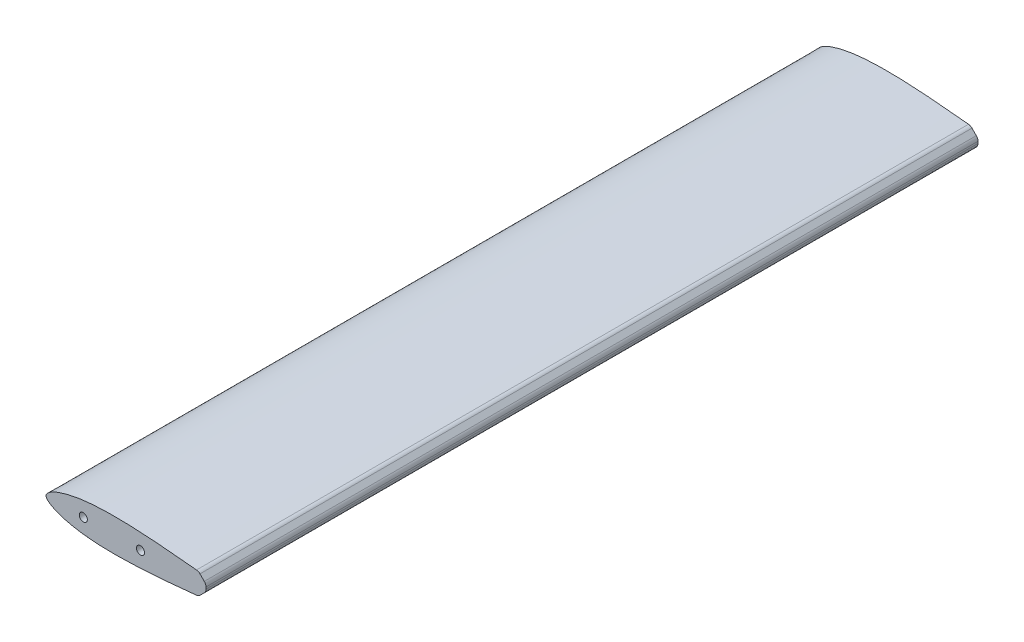
from build123d import *

# Parameters (mm, degrees)
BOSS_EXTRUDE1_DEPTH = 342.9
CUT_EXTRUDE1_REACH  = 726.83
SKETCH5_R           = 3.6000000000000014
CUT_EXTRUDE2_DEPTH  = 725.8296670733237
FILLET1_R           = 5.08


with BuildPart() as part:
    # Sketch4 → Boss-Extrude1 (new, symmetric)
    with BuildSketch(Plane.XY):
        with BuildLine():
            add(Edge.make_bspline(
                [(234.188, -3e-17), (234.1879999999999, 0.01555368673717536), (232.4627422380163, 0.0763011183498608), (230.74526647764503, 0.2925271697301719), (226.67713229868264, 0.685160998526905), (221.75356854698836, 1.1640077356321055), (215.37294620070008, 1.6852254916752147), (207.86062662630553, 2.3192547241588373), (199.2232284506973, 3.079647274565367), (189.62491700027604, 3.9790665220835195), (179.1985355820121, 5.004226397420742), (168.09946427080857, 6.136829344987135), (156.48495923102257, 7.353633283154771), (144.51299742857503, 8.611742711703746), (132.3399741562958, 9.871667449087782), (120.11646789402246, 11.085202621751511), (107.98355224875537, 12.19281227627895), (96.07511697796379, 13.149500525501221), (84.51142924294103, 13.902296199554154), (73.39893065705205, 14.404277626743035), (62.83036591934086, 14.617543900453633), (52.890708700755226, 14.52889921311447), (43.65270125249773, 14.118780647976617), (35.176869617070736, 13.380664351662944), (27.509827784431533, 12.317631060614895), (20.692419045179847, 10.965262556118512), (14.765041279961295, 9.389914810638238), (9.769355541344568, 7.6437531971927895), (5.7494434702079165, 5.796207761047075), (2.7281368480217365, 3.8707650647214633), (0.7551383825718299, 2.0668649583695786), (-0.30700200067074673, 1.697e-14), (0.7551383825717297, -2.0668649583693863), (2.728136848021755, -3.8707650647213954), (5.74944347020787, -5.7962077610469045), (9.769355541344595, -7.643753197192716), (14.765041279961304, -9.389914810638118), (20.69241904517994, -10.965262556118454), (27.509827784431586, -12.317631060614838), (35.17686961707083, -13.380664351662807), (43.65270125249773, -14.118780647976545), (52.89070870075546, -14.52889921311428), (62.83036591934106, -14.6175439004534), (73.39893065705176, -14.404277626743013), (84.51142924294103, -13.902296199554002), (96.07511697796434, -13.14950052550129), (107.98355224875506, -12.192812276278886), (120.11646789402214, -11.085202621751522), (132.33997415629577, -9.871667449087825), (144.5129974285734, -8.611742711703744), (156.48495923102104, -7.35363328315465), (168.0994642708087, -6.136829344987091), (179.19853558201262, -5.004226397420609), (189.62491700027604, -3.9790665220833614), (199.22322845069712, -3.0796472745652665), (207.86062662630465, -2.3192547241588723), (215.37294620069795, -1.685225491675168), (221.75356854698788, -1.164007735632043), (226.67713229868298, -0.6851609985268854), (230.74526647764517, -0.29252716973023074), (232.4627422380173, -0.07630111834986206), (234.18800000000007, -0.01555368673717459), (234.188, -4e-17)],
                knots=[0, 0, 0, 0, 0.00172563476379416, 0.00673974483178372, 0.01469595922799873, 0.0253585857018278, 0.03870100365136372, 0.05461872972547559, 0.07286704208588617, 0.09317428871059508, 0.11523617024491441, 0.1387268794816748, 0.16331405785466083, 0.1886523276510338, 0.214405506161386, 0.2402508820296905, 0.26587512076406683, 0.2909975504863303, 0.31535475594001566, 0.33872276926226763, 0.36092378194177993, 0.38180167100941004, 0.40120220798697487, 0.41904305185645374, 0.43526891007961177, 0.4498394774152121, 0.46270956731433055, 0.47379858539836944, 0.4830603475571684, 0.49049773275089165, 0.49613684706841527, 0.5, 0.5038631529315848, 0.5095022672491084, 0.5169396524428317, 0.5262014146016306, 0.5372904326856695, 0.550160522584788, 0.5647310899203883, 0.5809569481435463, 0.5987977920130252, 0.6181983289905899, 0.63907621805822, 0.6612772307377325, 0.6846452440599844, 0.7090024495136698, 0.7341248792359333, 0.7597491179703096, 0.7855944938386141, 0.8113476723489664, 0.8366859421453394, 0.8612731205183254, 0.8847638297550858, 0.9068257112894051, 0.9271329579141141, 0.9453812702745246, 0.9612989963486364, 0.9746414142981724, 0.9853040407720014, 0.9932602551682164, 0.9982743652362059, 1, 1, 1, 1], degree=3))
        make_face()
    extrude(amount=BOSS_EXTRUDE1_DEPTH, both=True)

    # Sketch5 → Cut-Extrude1 (cut, up to next)
    with BuildSketch(Plane(origin=(0, 0, -342.9), x_dir=(-1, 0, 0), z_dir=(0, 0, -1)), mode=Mode.PRIVATE) as cut_extrude1_sk1:
        with Locations((-33.147000000000006, -0.0394142186844621)):
            Circle(SKETCH5_R)
    cut_extrude1_tool1 = extrude(cut_extrude1_sk1.sketch, amount=-CUT_EXTRUDE1_REACH, mode=Mode.PRIVATE) & part.part
    # Sketch5 → Cut-Extrude1 (cut, up to next)
    with BuildSketch(Plane(origin=(0, 0, -342.9), x_dir=(-1, 0, 0), z_dir=(0, 0, -1)), mode=Mode.PRIVATE) as cut_extrude1_sk2:
        with Locations((-83.94699999999999, -0.09981915153421243)):
            Circle(SKETCH5_R)
    cut_extrude1_tool2 = extrude(cut_extrude1_sk2.sketch, amount=-CUT_EXTRUDE1_REACH, mode=Mode.PRIVATE) & part.part
    add(cut_extrude1_tool1.solids().sort_by_distance((33.147, -0.039414, -342.9))[0], mode=Mode.SUBTRACT)
    add(cut_extrude1_tool2.solids().sort_by_distance((83.947, -0.099819, -342.9))[0], mode=Mode.SUBTRACT)

    # Sketch6 → Cut-Extrude2 (cut, through all)
    with BuildSketch(Plane.XY.offset(342.9)):
        with BuildLine():
            add(Edge.make_bspline(
                [(135.48498795299662, -9.542562997842602), (138.51642752051396, -9.232182264245022), (145.5564210695249, -8.502091416259107), (156.48495923102104, -7.35363328315465), (168.0994642708087, -6.136829344987091), (179.19853558201262, -5.004226397420609), (189.62491700027604, -3.9790665220833614), (199.22322845069712, -3.0796472745652665), (207.86062662630465, -2.3192547241588723), (215.37294620069795, -1.685225491675168), (221.75356854698788, -1.164007735632043), (226.67713229868298, -0.6851609985268854), (230.74526647764517, -0.29252716973023074), (232.4627422380173, -0.07630111834986206), (234.62973256479145, 1.02e-15), (232.4627422380163, 0.0763011183498608), (230.74526647764503, 0.2925271697301719), (226.67713229868264, 0.685160998526905), (221.75356854698836, 1.1640077356321055), (215.37294620070008, 1.6852254916752147), (207.86062662630553, 2.3192547241588373), (199.2232284506973, 3.079647274565367), (189.62491700027604, 3.9790665220835195), (179.1985355820121, 5.004226397420742), (168.09946427080857, 6.136829344987135), (156.48495923102257, 7.353633283154773), (145.56280662770087, 8.50142037077148), (138.5292004831092, 9.230857621064734), (135.50414996623826, 9.540600998950179)],
                knots=[0.7921903107561222, 0.7921903107561222, 0.7921903107561222, 0.7921903107561222, 0.8113476723489665, 0.83668594214534, 0.8612731205183264, 0.8847638297550873, 0.906825711289407, 0.9271329579141164, 0.9453812702745272, 0.9612989963486394, 0.9746414142981756, 0.9853040407720048, 0.99326025516822, 0.9982743652362097, 1.0000000000000038, 1.001725634763798, 1.0067397448317874, 1.0146959592280025, 1.0253585857018315, 1.0387010036513673, 1.0546187297254792, 1.0728670420858897, 1.0931742887105984, 1.1152361702449176, 1.138726879481678, 1.163314057854664, 1.1886523276510368, 1.207769324073894, 1.207769324073894, 1.207769324073894, 1.207769324073894], degree=3))
            Line((135.50414996623823, 9.540600998950184), (142.11299999999997, 2.9317509651883054))
            Line((142.11299999999977, 2.9317509651883054), (142.1129999999998, -2.914550950839047))
            Line((142.1129999999998, -2.9145509508390477), (135.48498795299662, -9.542562997842602))
        make_face()
    extrude(amount=-CUT_EXTRUDE2_DEPTH, mode=Mode.SUBTRACT)

    # Fillet1
    fillet1_edges = [part.edges().sort_by_distance(p)[0] for p in [
        (135.50414996623823, 9.540600998950183, -171.44999999999993),
        (142.1129999999999, 2.9317509651883054, 0),
        (142.1129999999998, -2.9145509508390472, 0),
        (135.48498795299662, -9.542562997842602, 171.45),
    ]]
    fillet(fillet1_edges, radius=FILLET1_R)


solid = part.part
